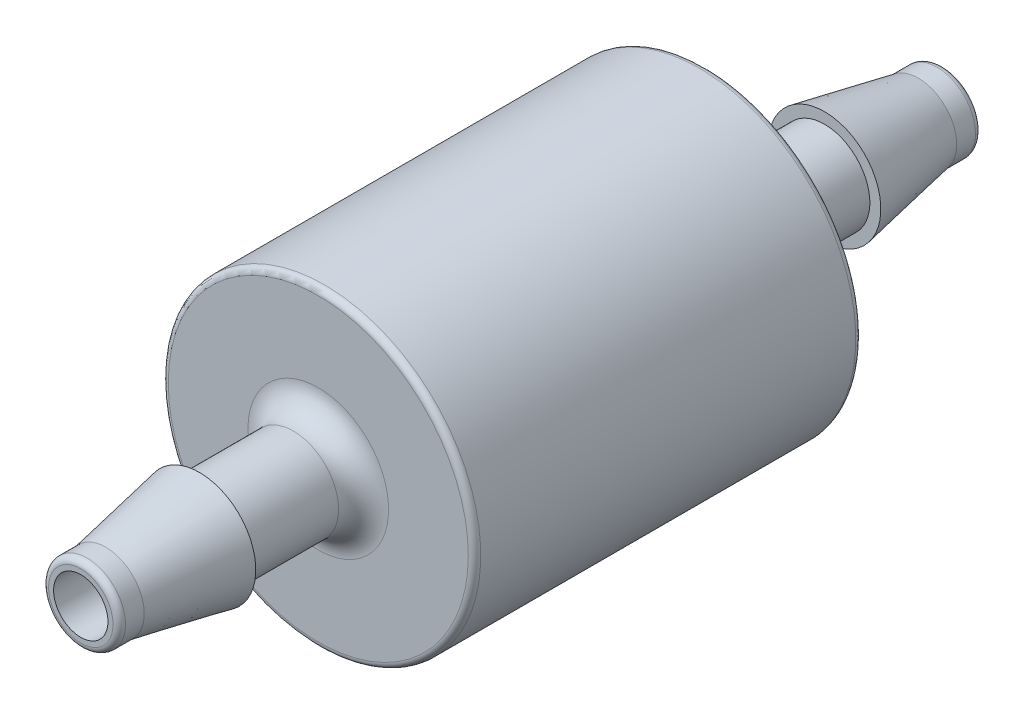
from build123d import *


with BuildPart() as part:
    # Sketch2 → Revolve1 (revolve)
    with BuildSketch(Plane(origin=(0, 0, 0), x_dir=(0, 0, -1), z_dir=(1, 0, 0))):
        with BuildLine():
            Line((-17.526, 1.1049), (-17.526, 1.3081))
            ThreePointArc((-17.526, 1.3081), (-17.451605122, 1.487705122), (-17.272, 1.5621))
            Line((-17.272, 1.5621), (-16.51, 1.5621))
            Line((-16.51, 1.5621), (-12.7, 2.286))
            Line((-12.7, 2.286), (-12.7, 1.8415))
            Line((-12.7, 1.8415), (-8.89, 1.8415))
            ThreePointArc((-8.89, 1.8415), (-8.17157951, 2.13907951), (-7.874, 2.8575))
            Line((-7.874, 2.8575), (-7.874, 6.096))
            ThreePointArc((-7.874, 6.096), (-7.799605122, 6.275605122), (-7.62, 6.35))
            Line((-7.62, 6.35), (7.62, 6.35))
            ThreePointArc((7.62, 6.35), (7.799605122, 6.275605122), (7.874, 6.096))
            Line((7.874, 6.096), (7.874, 2.8575))
            ThreePointArc((7.874, 2.8575), (8.17157951, 2.13907951), (8.89, 1.8415))
            Line((8.89, 1.8415), (12.7, 1.8415))
            Line((12.7, 1.8415), (12.7, 2.286))
            Line((12.7, 2.286), (16.51, 1.5621))
            Line((16.51, 1.5621), (17.272, 1.5621))
            ThreePointArc((17.272, 1.5621), (17.451605122, 1.487705122), (17.526, 1.3081))
            Line((17.526, 1.3081), (17.526, 1.1049))
            Line((17.526, 1.1049), (-17.526, 1.1049))
        make_face()
    revolve(axis=Axis((0, 0, -17.526), (0, 0, 1)))


solid = part.part
